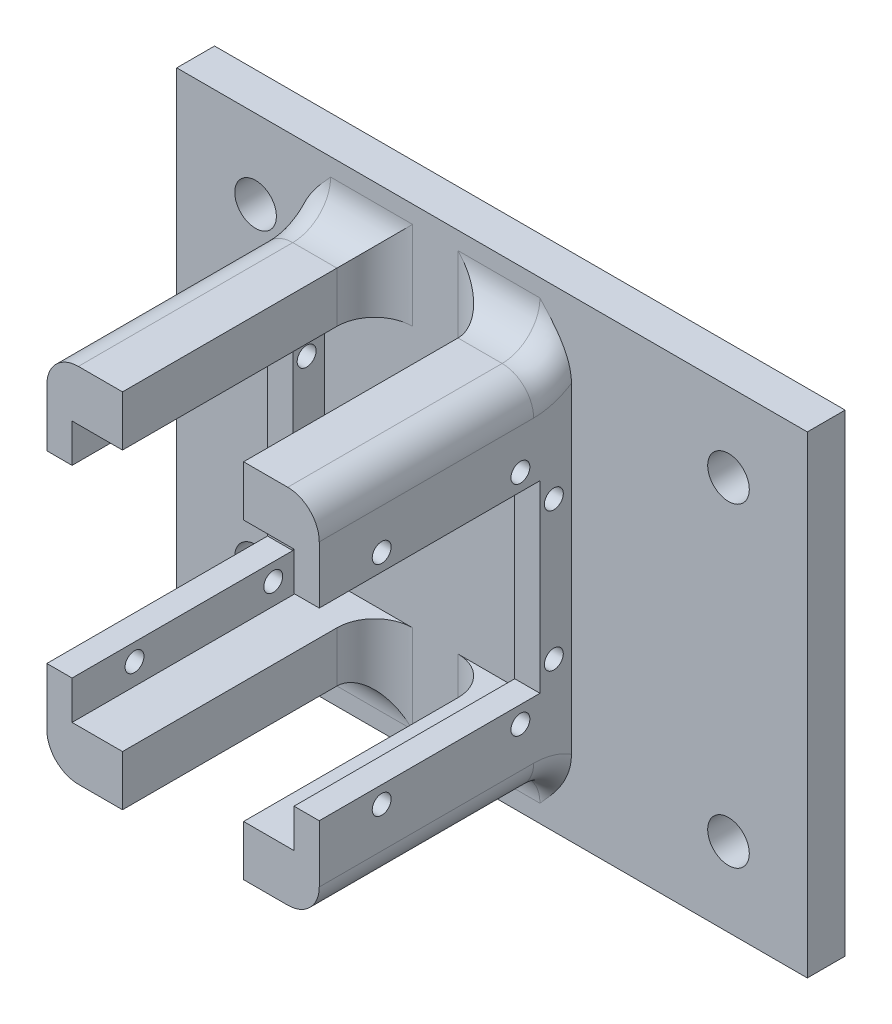
from build123d import *

# Parameters (mm, degrees)
SKETCH_1_W          = 100
SKETCH_1_H          = 75
SKETCH_1_R          = 3.3
EXTRUDE_1_DEPTH     = 6
EXTRUDE_2_DEPTH     = 40
CUT_EXTRUDE_1_REACH = 102.093
SKETCH_3_R          = 1.5
SKETCH_3_W          = 35
SKETCH_3_H          = 29.2
FILLET_1_R          = 6
FILLET_2_R          = 5


with BuildPart() as part:
    # 스케치1 → 보스-돌출1 (new body)
    with BuildSketch(Plane.XY):
        Rectangle(SKETCH_1_W, SKETCH_1_H)
        with Locations((-37.5, 25)):
            Circle(SKETCH_1_R, mode=Mode.SUBTRACT)
        with Locations((37.5, 25)):
            Circle(SKETCH_1_R, mode=Mode.SUBTRACT)
        with Locations((37.5, -25)):
            Circle(SKETCH_1_R, mode=Mode.SUBTRACT)
        with Locations((-37.5, -25)):
            Circle(SKETCH_1_R, mode=Mode.SUBTRACT)
    extrude(amount=EXTRUDE_1_DEPTH)

    # 스케치2 → 보스-돌출2 (add)
    with BuildSketch(Plane.XY.offset(6)):
        Polygon((-18.6, 20.7), (-18.6, 28.7), (-30.6, 28.7), (-30.6, -28.7), (-18.6, -28.7), (-18.6, -20.7), (-26.6, -20.7), (-26.6, 20.7), align=None)
        Polygon((8.6, -20.7), (0.6, -20.7), (0.6, -28.7), (12.6, -28.7), (12.6, 28.7), (0.6, 28.7), (0.6, 20.7), (8.6, 20.7), align=None)
    extrude(amount=EXTRUDE_2_DEPTH)

    # 컷-돌출1: up to this face of the body (flat: up to its plane)
    cut_extrude_1_end = Plane(part.part.faces().sort_by_distance((12.6, 0, 26))[0])
    # 스케치3 → 컷-돌출1 (cut, up to the picked face)
    with BuildSketch(Plane.ZY.offset(30.6), mode=Mode.PRIVATE) as cut_extrude_1_sk1:
        with Locations((8.8, 11)):
            Circle(SKETCH_3_R)
    cut_extrude_1_tool1 = split(extrude(cut_extrude_1_sk1.sketch, amount=-CUT_EXTRUDE_1_REACH, mode=Mode.PRIVATE), bisect_by=cut_extrude_1_end, keep=Keep.BOTH, mode=Mode.PRIVATE)
    # 스케치3 → 컷-돌출1 (cut, up to the picked face)
    with BuildSketch(Plane.ZY.offset(30.6), mode=Mode.PRIVATE) as cut_extrude_1_sk2:
        with Locations((14.1, 17.3)):
            Circle(SKETCH_3_R)
    cut_extrude_1_tool2 = split(extrude(cut_extrude_1_sk2.sketch, amount=-CUT_EXTRUDE_1_REACH, mode=Mode.PRIVATE), bisect_by=cut_extrude_1_end, keep=Keep.BOTH, mode=Mode.PRIVATE)
    # 스케치3 → 컷-돌출1 (cut, up to the picked face)
    with BuildSketch(Plane.ZY.offset(30.6), mode=Mode.PRIVATE) as cut_extrude_1_sk3:
        with Locations((36.1, 17.3)):
            Circle(SKETCH_3_R)
    cut_extrude_1_tool3 = split(extrude(cut_extrude_1_sk3.sketch, amount=-CUT_EXTRUDE_1_REACH, mode=Mode.PRIVATE), bisect_by=cut_extrude_1_end, keep=Keep.BOTH, mode=Mode.PRIVATE)
    # 스케치3 → 컷-돌출1 (cut, up to the picked face)
    with BuildSketch(Plane.ZY.offset(30.6), mode=Mode.PRIVATE) as cut_extrude_1_sk4:
        with Locations((8.8, -11)):
            Circle(SKETCH_3_R)
    cut_extrude_1_tool4 = split(extrude(cut_extrude_1_sk4.sketch, amount=-CUT_EXTRUDE_1_REACH, mode=Mode.PRIVATE), bisect_by=cut_extrude_1_end, keep=Keep.BOTH, mode=Mode.PRIVATE)
    # 스케치3 → 컷-돌출1 (cut, up to the picked face)
    with BuildSketch(Plane.ZY.offset(30.6), mode=Mode.PRIVATE) as cut_extrude_1_sk5:
        with Locations((14.1, -17.3)):
            Circle(SKETCH_3_R)
    cut_extrude_1_tool5 = split(extrude(cut_extrude_1_sk5.sketch, amount=-CUT_EXTRUDE_1_REACH, mode=Mode.PRIVATE), bisect_by=cut_extrude_1_end, keep=Keep.BOTH, mode=Mode.PRIVATE)
    # 스케치3 → 컷-돌출1 (cut, up to the picked face)
    with BuildSketch(Plane.ZY.offset(30.6), mode=Mode.PRIVATE) as cut_extrude_1_sk6:
        with Locations((36.1, -17.3)):
            Circle(SKETCH_3_R)
    cut_extrude_1_tool6 = split(extrude(cut_extrude_1_sk6.sketch, amount=-CUT_EXTRUDE_1_REACH, mode=Mode.PRIVATE), bisect_by=cut_extrude_1_end, keep=Keep.BOTH, mode=Mode.PRIVATE)
    # 스케치3 → 컷-돌출1 (cut, up to the picked face)
    with BuildSketch(Plane.ZY.offset(30.6), mode=Mode.PRIVATE) as cut_extrude_1_sk7:
        with Locations((28.5, 0)):
            Rectangle(SKETCH_3_W, SKETCH_3_H)
    cut_extrude_1_tool7 = split(extrude(cut_extrude_1_sk7.sketch, amount=-CUT_EXTRUDE_1_REACH, mode=Mode.PRIVATE), bisect_by=cut_extrude_1_end, keep=Keep.BOTH, mode=Mode.PRIVATE)
    add(cut_extrude_1_tool1.solids().sort_by(Axis((-30.6, 11, 8.8), (1, 0, 0)))[0], mode=Mode.SUBTRACT)
    add(cut_extrude_1_tool2.solids().sort_by(Axis((-30.6, 17.3, 14.1), (1, 0, 0)))[0], mode=Mode.SUBTRACT)
    add(cut_extrude_1_tool3.solids().sort_by(Axis((-30.6, 17.3, 36.1), (1, 0, 0)))[0], mode=Mode.SUBTRACT)
    add(cut_extrude_1_tool4.solids().sort_by(Axis((-30.6, -11, 8.8), (1, 0, 0)))[0], mode=Mode.SUBTRACT)
    add(cut_extrude_1_tool5.solids().sort_by(Axis((-30.6, -17.3, 14.1), (1, 0, 0)))[0], mode=Mode.SUBTRACT)
    add(cut_extrude_1_tool6.solids().sort_by(Axis((-30.6, -17.3, 36.1), (1, 0, 0)))[0], mode=Mode.SUBTRACT)
    add(cut_extrude_1_tool7.solids().sort_by(Axis((-30.6, 0, 28.5), (1, 0, 0)))[0], mode=Mode.SUBTRACT)

    # 필렛1
    fillet_1_edges = [part.edges().sort_by_distance(p)[0] for p in [
        (-18.6, 24.7, 6),
        (-24.6, 28.7, 6),
        (-24.6, -28.7, 6),
        (-18.6, -24.7, 6),
        (0.6, -24.7, 6),
        (6.6, -28.7, 6),
        (6.6, 28.7, 6),
        (0.6, 24.7, 6),
    ]]
    fillet(fillet_1_edges, radius=FILLET_1_R)

    # 필렛2
    # the kernel refuses this fillet: 5 mm, written as the material it takes off along each edge
    with BuildSketch(Plane(origin=(-30.6, 34.7, 12), x_dir=(0, 0.8710924829717933, 0.49111901420127907), z_dir=(0, -0.49111901420127907, 0.8710924829717933))) as fillet_2_piece_1_section:
        with BuildLine():
            CenterArc((6 + FILLET_2_R, -FILLET_2_R), FILLET_2_R, 90, 90)
            Line((6, -FILLET_2_R), (6, 0))
            Line((6, 0), (6 + FILLET_2_R, 0))
        make_face()
    fillet_2_piece_1 = revolve(axis=Axis((-30.6, 34.7, 12), (-1, 0, 0)), revolution_arc=209.414157698, mode=Mode.PRIVATE)
    fillet_2_piece_1 = split(fillet_2_piece_1, bisect_by=Plane(origin=(-29.099532235, 30.223820848, 6), z_dir=(0, 0, 1)), keep=Keep.TOP, mode=Mode.PRIVATE)
    add(fillet_2_piece_1, mode=Mode.SUBTRACT)
    with BuildSketch(Plane(origin=(12.6, 34.7, 12), x_dir=(0, 0.8710924829717934, 0.4911190142012785), z_dir=(0, -0.4911190142012785, 0.8710924829717934))) as fillet_2_piece_2_section:
        with BuildLine():
            CenterArc((6 + FILLET_2_R, FILLET_2_R), FILLET_2_R, 180, 90)
            Line((6 + FILLET_2_R, 0), (6, 0))
            Line((6, 0), (6, FILLET_2_R))
        make_face()
    fillet_2_piece_2 = revolve(axis=Axis((12.6, 34.7, 12), (-1, 0, 0)), revolution_arc=209.414157698, mode=Mode.PRIVATE)
    fillet_2_piece_2 = split(fillet_2_piece_2, bisect_by=Plane(origin=(11.099532075, 30.223821009, 6), z_dir=(0, 0, 1)), keep=Keep.TOP, mode=Mode.PRIVATE)
    add(fillet_2_piece_2, mode=Mode.SUBTRACT)
    with BuildSketch(Plane(origin=(12.6, -34.7, 12), x_dir=(0, -0.8710924829717933, 0.49111901420127907), z_dir=(0, 0.49111901420127907, 0.8710924829717933))) as fillet_2_piece_3_section:
        with BuildLine():
            CenterArc((6 + FILLET_2_R, -FILLET_2_R), FILLET_2_R, 90, 90)
            Line((6, -FILLET_2_R), (6, 0))
            Line((6, 0), (6 + FILLET_2_R, 0))
        make_face()
    fillet_2_piece_3 = revolve(axis=Axis((12.6, -34.7, 12), (1, 0, 0)), revolution_arc=209.414157698, mode=Mode.PRIVATE)
    fillet_2_piece_3 = split(fillet_2_piece_3, bisect_by=Plane(origin=(11.099532513, -30.223820921, 6), z_dir=(0, 0, 1)), keep=Keep.TOP, mode=Mode.PRIVATE)
    add(fillet_2_piece_3, mode=Mode.SUBTRACT)
    with BuildSketch(Plane(origin=(-30.6, -34.7, 12), x_dir=(0, -0.8710924829717931, 0.4911190142012795), z_dir=(0, 0.4911190142012795, 0.8710924829717931))) as fillet_2_piece_4_section:
        with BuildLine():
            CenterArc((6 + FILLET_2_R, FILLET_2_R), FILLET_2_R, 180, 90)
            Line((6 + FILLET_2_R, 0), (6, 0))
            Line((6, 0), (6, FILLET_2_R))
        make_face()
    fillet_2_piece_4 = revolve(axis=Axis((-30.6, -34.7, 12), (1, 0, 0)), revolution_arc=209.414157698, mode=Mode.PRIVATE)
    fillet_2_piece_4 = split(fillet_2_piece_4, bisect_by=Plane(origin=(-29.099532146, -30.223820899, 6), z_dir=(0, 0, 1)), keep=Keep.TOP, mode=Mode.PRIVATE)
    add(fillet_2_piece_4, mode=Mode.SUBTRACT)
    with BuildSketch(Plane(origin=(-30.6, 28.7, 12), x_dir=(1, 0, 0), z_dir=(0, 0, 1)), Plane(origin=(12.6, -28.7, 12), x_dir=(-1, 0, 0), z_dir=(0, 0, 1))) as fillet_2_piece_5:
        with BuildLine():
            CenterArc((FILLET_2_R, -FILLET_2_R), FILLET_2_R, 90, 90)
            Line((0, -FILLET_2_R), (0, 0))
            Line((0, 0), (FILLET_2_R, 0))
        make_face()
    extrude(amount=46.5, mode=Mode.SUBTRACT)
    with BuildSketch(Plane(origin=(-30.6, -28.7, 12), x_dir=(1, 0, 0), z_dir=(0, 0, 1)), Plane(origin=(12.6, 28.7, 12), x_dir=(-1, 0, 0), z_dir=(0, 0, 1))) as fillet_2_piece_6:
        with BuildLine():
            CenterArc((FILLET_2_R, FILLET_2_R), FILLET_2_R, 180, 90)
            Line((0, FILLET_2_R), (0, 0))
            Line((0, 0), (FILLET_2_R, 0))
        make_face()
    extrude(amount=46.5, mode=Mode.SUBTRACT)


solid = part.part
